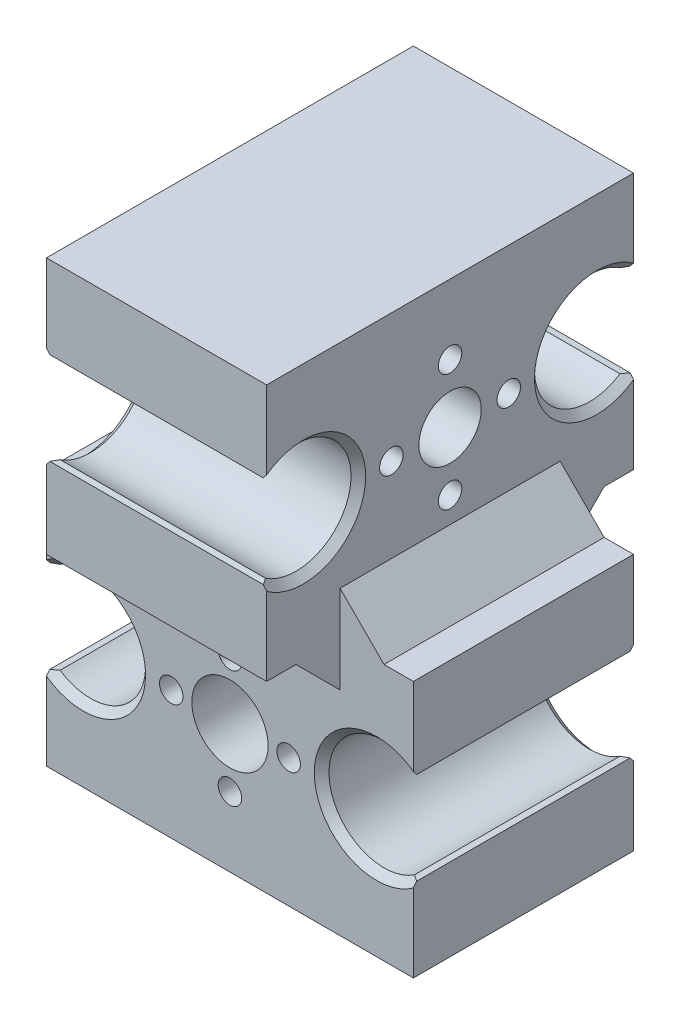
from build123d import *

# Parameters (mm, degrees)
SKETCH_1_W              = 50
SKETCH_1_H              = 35
EXTRUDE_1_DEPTH         = 30
HOLE_WIZARD_360_D       = 8.5
HOLE_WIZARD_465_D       = 3.2
HOLE_WIZARD_619_D       = 15
CHAMFER_1_SIZE          = 1
CHAMFER_1_SIZE_2        = 0.708203932
SKETCH_8_W              = 15
SKETCH_8_H              = 15
EXTRUDE_2_DEPTH         = 35
HOLE_WIZARD_1775_D      = 10.4
HOLE_WIZARD_1775_DEPTH  = 11
HOLE_WIZARD_1887_D      = 10.4
HOLE_WIZARD_1887_DEPTH  = 11
HOLE_WIZARD_2064_D      = 8.5
CUT_EXTRUDE_START       = -40
CUT_EXTRUDE_1_OUTLINE_R = 1.6
CUT_EXTRUDE_1_DEPTH     = 30
CHAMFER_2_SIZE          = 1
CHAMFER_2_SIZE_2        = 0.708203933
RIB_START               = -15
RIB_8_DEPTH             = 30
RIB_10_REACH            = 72.578
SKETCH_20_WALL_W        = 151.64122351
SKETCH_20_WALL_H        = 30


with BuildPart() as part:
    # 草图1 → 凸台-拉伸1 (new body)
    with BuildSketch(Plane.XY):
        Rectangle(SKETCH_1_W, SKETCH_1_H)
    extrude(amount=EXTRUDE_1_DEPTH)

    # Hole Wizard 360 (through all)
    with Locations(Plane.XY.offset(30)):
        with Locations((0, 0)):
            Hole(HOLE_WIZARD_360_D / 2)

    # Hole Wizard 465 (through all)
    with Locations(Plane.XY.offset(30)):
        with Locations((8, 0), (0, 8), (-8, 0), (0, -8)):
            Hole(HOLE_WIZARD_465_D / 2)

    # Hole Wizard 619 (through all)
    with Locations(Plane.XY.offset(30)):
        with Locations((20, 0), (-20, 0)):
            Hole(HOLE_WIZARD_619_D / 2)

    # 倒角1
    # the kernel refuses this chamfer: 1, 0.708203932 mm, written as the material it takes off along each edge
    with BuildSketch(Plane(origin=(-20, 0, 0), x_dir=(-0.8790200859122482, 0.4767847402789059, 0), z_dir=(-0.4767847402789059, -0.8790200859122482, 0))) as chamfer_1_piece_1:
        Polygon((7.5, -CHAMFER_1_SIZE), (7.5 + CHAMFER_1_SIZE, 0), (7.5, 0), align=None)
    revolve(axis=Axis((-20, 0, 0), (0, 0, -1)), revolution_arc=303.048763938, mode=Mode.SUBTRACT)
    with BuildSketch(Plane(origin=(-20, 0, 30), x_dir=(-0.879020085912248, 0.47678474027890627, 0), z_dir=(-0.47678474027890627, -0.879020085912248, 0))) as chamfer_1_piece_2:
        Polygon((7.5 + CHAMFER_1_SIZE, 0), (7.5, CHAMFER_1_SIZE), (7.5, 0), align=None)
    revolve(axis=Axis((-20, 0, 30), (0, 0, -1)), revolution_arc=303.048763938, mode=Mode.SUBTRACT)
    with BuildSketch(Plane(origin=(20, 0, 30), x_dir=(0.879020085912248, -0.4767847402789061, 0), z_dir=(0.4767847402789061, 0.879020085912248, 0))) as chamfer_1_piece_3:
        Polygon((7.5 + CHAMFER_1_SIZE, 0), (7.5, CHAMFER_1_SIZE), (7.5, 0), align=None)
    revolve(axis=Axis((20, 0, 30), (0, 0, -1)), revolution_arc=303.048763938, mode=Mode.SUBTRACT)
    with BuildSketch(Plane(origin=(20, 0, 0), x_dir=(0.8790200859122481, 0.476784740278906, 0), z_dir=(0.476784740278906, -0.8790200859122481, 0))) as chamfer_1_piece_4:
        Polygon((7.5, CHAMFER_1_SIZE), (7.5 + CHAMFER_1_SIZE, 0), (7.5, 0), align=None)
    revolve(axis=Axis((20, 0, 0), (0, 0, 1)), revolution_arc=303.048763938, mode=Mode.SUBTRACT)
    with BuildSketch(Plane(origin=(-25, 5.590169944, 32.778051389), x_dir=(0.7914486393779661, 0.611235675682274, 0), z_dir=(0, 0, -1)), Plane(origin=(25, -5.590169944, 32.778051389), x_dir=(-0.7914486393779661, -0.611235675682274, 0), z_dir=(0, 0, -1))) as chamfer_1_piece_5:
        with BuildLine():
            Line((1.080663788, 0), (CHAMFER_1_SIZE_2 * 0.611235676113, -CHAMFER_1_SIZE_2 * 0.791448639936))
            Line((CHAMFER_1_SIZE_2 * 0.611235676113, -CHAMFER_1_SIZE_2 * 0.791448639936), (0, 0))
            ThreePointArc((0, 0), (0.555522087, -0.019473843), (1.080663788, 0))
        make_face()
    extrude(amount=35.556102778, mode=Mode.SUBTRACT)
    with BuildSketch(Plane(origin=(-25, -5.590169944, 32.778051389), x_dir=(0.7914486393779665, -0.6112356756822735, 0), z_dir=(0, 0, -1))) as chamfer_1_piece_6:
        with BuildLine():
            Line((1.080663788, 0), (CHAMFER_1_SIZE_2 * 0.611235676113, CHAMFER_1_SIZE_2 * 0.791448639936))
            Line((CHAMFER_1_SIZE_2 * 0.611235676113, CHAMFER_1_SIZE_2 * 0.791448639936), (0, 0))
            ThreePointArc((0, 0), (0.555522087, 0.019473843), (1.080663788, 0))
        make_face()
    extrude(amount=35.556102778, mode=Mode.SUBTRACT)
    with BuildSketch(Plane(origin=(25, 5.590169944, 32.778051389), x_dir=(0, 1, 0), z_dir=(0, 0, -1))) as chamfer_1_piece_7:
        with BuildLine():
            Line((CHAMFER_1_SIZE_2, 0), (0.660540261, -0.855289885))
            ThreePointArc((0.660540261, -0.855289885), (0.354967464, -0.427764092), (0, 0))
            Line((0, 0), (CHAMFER_1_SIZE_2, 0))
        make_face()
    extrude(amount=35.556102778, mode=Mode.SUBTRACT)

    # 草图8 → 凸台-拉伸2 (add)
    with BuildSketch(Plane(origin=(0, 17.5, 0), x_dir=(1, 0, 0), z_dir=(0, 1, 0))):
        Polygon((15, -30), (0, -30), (-15, -30), (-15, -40), (15, -40), align=None)
        with Locations((-7.5, -22.5)):
            Rectangle(SKETCH_8_W, SKETCH_8_H)
        with Locations((-7.5, -7.5)):
            Rectangle(SKETCH_8_W, SKETCH_8_H)
        Polygon((-15, 0), (0, 0), (15, 0), (15, 10), (-15, 10), align=None)
        with Locations((7.5, -7.5)):
            Rectangle(SKETCH_8_W, SKETCH_8_H)
        with Locations((7.5, -22.5)):
            Rectangle(SKETCH_8_W, SKETCH_8_H)
    extrude(amount=EXTRUDE_2_DEPTH)

    # Hole Wizard 1775
    with Locations(Plane.XY.offset(30)):
        with Locations((0, 0)):
            Hole(HOLE_WIZARD_1775_D / 2, depth=HOLE_WIZARD_1775_DEPTH)

    # Hole Wizard 1887
    with Locations(Plane.ZY.offset(15)):
        with Locations((15, 35)):
            Hole(HOLE_WIZARD_1887_D / 2, depth=HOLE_WIZARD_1887_DEPTH)

    # Hole Wizard 2064 (through all)
    with Locations(Plane.ZY.offset(15)):
        with Locations((15, 35)):
            Hole(HOLE_WIZARD_2064_D / 2)

    # 切除-拉伸1: read off the stored shape, not the designer's step
    # 切除-拉伸1 outline → 切除-拉伸1 (cut)
    with BuildSketch(Plane.ZY.offset(25).offset(CUT_EXTRUDE_START)):
        with Locations((23, 35)):
            Circle(CUT_EXTRUDE_1_OUTLINE_R)
        with Locations((7, 35)):
            Circle(CUT_EXTRUDE_1_OUTLINE_R)
        with Locations((15, 43)):
            Circle(CUT_EXTRUDE_1_OUTLINE_R)
        with BuildLine():
            Line((40, 29.409830056), (40, 40.590169944))
            ThreePointArc((40, 40.590169944), (27.5, 35), (40, 29.409830056))
        make_face()
        with Locations((15, 27)):
            Circle(CUT_EXTRUDE_1_OUTLINE_R)
        with BuildLine():
            Line((-10, 40.590169944), (-10, 29.409830056))
            ThreePointArc((-10, 29.409830056), (2.5, 35), (-10, 40.590169944))
        make_face()
    extrude(amount=CUT_EXTRUDE_1_DEPTH, mode=Mode.SUBTRACT)

    # 倒角2
    # the kernel refuses this chamfer: 1, 0.708203933 mm, written as the material it takes off along each edge
    with BuildSketch(Plane(origin=(-15, 35, 35), x_dir=(0, 0.4767847403128172, 0.8790200858938546), z_dir=(0, -0.8790200858938546, 0.4767847403128172))) as chamfer_2_piece_1:
        Polygon((7.5 + CHAMFER_2_SIZE, 0), (7.5, -CHAMFER_2_SIZE), (7.5, 0), align=None)
    revolve(axis=Axis((-15, 35, 35), (-1, 0, 0)), revolution_arc=303.048763934, mode=Mode.SUBTRACT)
    with BuildSketch(Plane(origin=(-15, 35, -5), x_dir=(0, -0.4767847403128172, -0.8790200858938546), z_dir=(0, 0.8790200858938546, -0.4767847403128172))) as chamfer_2_piece_2:
        Polygon((7.5 + CHAMFER_2_SIZE, 0), (7.5, -CHAMFER_2_SIZE), (7.5, 0), align=None)
    revolve(axis=Axis((-15, 35, -5), (-1, 0, 0)), revolution_arc=303.048763934, mode=Mode.SUBTRACT)
    with BuildSketch(Plane(origin=(15, 35, -5), x_dir=(0, -0.4767847403128172, -0.8790200858938546), z_dir=(0, 0.8790200858938546, -0.4767847403128172))) as chamfer_2_piece_3:
        Polygon((7.5 + CHAMFER_2_SIZE, 0), (7.5, CHAMFER_2_SIZE), (7.5, 0), align=None)
    revolve(axis=Axis((15, 35, -5), (-1, 0, 0)), revolution_arc=303.048763934, mode=Mode.SUBTRACT)
    with BuildSketch(Plane(origin=(15, 35, 35), x_dir=(0, 0.4767847403128172, 0.8790200858938546), z_dir=(0, -0.8790200858938546, 0.4767847403128172))) as chamfer_2_piece_4:
        Polygon((7.5 + CHAMFER_2_SIZE, 0), (7.5, CHAMFER_2_SIZE), (7.5, 0), align=None)
    revolve(axis=Axis((15, 35, 35), (-1, 0, 0)), revolution_arc=303.048763934, mode=Mode.SUBTRACT)
    with BuildSketch(Plane(origin=(17.778051389, 40.590169944, -10), x_dir=(0, 0.6112356756567692, 0.7914486393976635), z_dir=(-1, 0, 0))) as chamfer_2_piece_5:
        with BuildLine():
            Line((1.080663788, 0), (CHAMFER_2_SIZE_2 * 0.611235675226, CHAMFER_2_SIZE_2 * 0.79144863884))
            Line((CHAMFER_2_SIZE_2 * 0.611235675226, CHAMFER_2_SIZE_2 * 0.79144863884), (0, 0))
            ThreePointArc((0, 0), (0.555522087, 0.019473843), (1.080663788, 0))
        make_face()
    extrude(amount=35.556102778, mode=Mode.SUBTRACT)
    with BuildSketch(Plane(origin=(17.778051389, 29.409830056, -10), x_dir=(0, -1, 0), z_dir=(-1, 0, 0)), Plane(origin=(17.778051389, 40.590169944, 40), x_dir=(0, 1, 0), z_dir=(-1, 0, 0))) as chamfer_2_piece_6:
        with BuildLine():
            Line((CHAMFER_2_SIZE_2, 0), (0.660540261, 0.855289885))
            ThreePointArc((0.660540261, 0.855289885), (0.354967464, 0.427764092), (0, 0))
            Line((0, 0), (CHAMFER_2_SIZE_2, 0))
        make_face()
    extrude(amount=35.556102778, mode=Mode.SUBTRACT)
    with BuildSketch(Plane(origin=(17.778051389, 29.409830056, 40), x_dir=(0, -1, 0), z_dir=(-1, 0, 0))) as chamfer_2_piece_7:
        with BuildLine():
            Line((CHAMFER_2_SIZE_2, 0), (0.660540261, -0.855289885))
            ThreePointArc((0.660540261, -0.855289885), (0.354967464, -0.427764092), (0, 0))
            Line((0, 0), (CHAMFER_2_SIZE_2, 0))
        make_face()
    extrude(amount=35.556102778, mode=Mode.SUBTRACT)

    # 筋8: read off the stored shape, not the designer's step
    # 筋8 outline → 筋8 (add)
    with BuildSketch(Plane.XY.offset(15).offset(RIB_START)):
        Polygon((21, 17.5), (15, 23.5), (15, 17.5), align=None)
    rib_8 = extrude(amount=RIB_8_DEPTH)

    # 镜向3: 筋8 across plane
    add(rib_8.mirror(Plane.ZY))

    # 草图20 wall → 筋10 (add, up to next)
    with BuildSketch(Plane(origin=(0, 14.5, 33), x_dir=(0, -0.707106781187, -0.707106781187), z_dir=(0, -0.707106781187, 0.707106781187)), mode=Mode.PRIVATE) as rib_10_sk1:
        Rectangle(SKETCH_20_WALL_W, SKETCH_20_WALL_H)
    rib_10_tool1 = extrude(rib_10_sk1.sketch, amount=-RIB_10_REACH, mode=Mode.PRIVATE) - part.part
    rib_10 = rib_10_tool1.solids().sort_by_distance((0, 14.5, 33))[0]
    add(rib_10)

    # 镜向4: 筋10 across plane
    add(rib_10.mirror(Plane.XY.offset(15)))


solid = part.part
